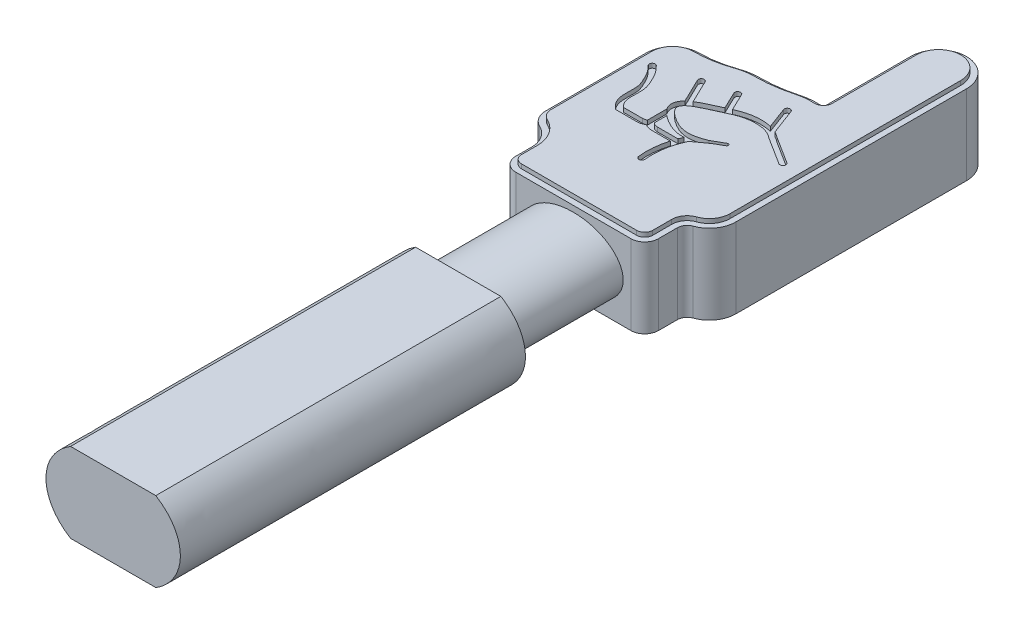
from build123d import *

# Parameters (mm, degrees)
BOSS_EXTRU_1_DEPTH  = 14.6
CUT_EXTRUDE1_DEPTH  = 0.75
CUT_EXTRUDE2_START  = -0.75
CUT_EXTRUDE2_DEPTH  = 0.75
SKETCH3_RX          = 8.68108217
SKETCH3_RY          = 5.903845931
BOSS_EXTRUDE1_DEPTH = 20
BOSS_EXTRUDE4_DEPTH = 60


with BuildPart() as part:
    # Esquisse2 → Boss.-Extru.1 (new body)
    with BuildSketch(Plane(origin=(0, 0, 0), x_dir=(1, 0, 0), z_dir=(0, 1, 0))):
        with BuildLine():
            Line((-461.351388226, 50.678431152), (-461.351388226, 90.775522892))
            ThreePointArc((-461.351388226, 90.775522892), (-466.211366791, 95.635501457), (-471.071345356, 90.775522892))
            Line((-471.071345356, 90.775522892), (-471.071345356, 76.175522892))
            ThreePointArc((-471.071345356, 76.175522892), (-471.248130994, 75.769164395), (-471.66594897, 75.621487285))
            ThreePointArc((-471.66594897, 75.621487285), (-473.268553235, 75.597795011), (-474.843817202, 75.302083679))
            ThreePointArc((-474.843817202, 75.302083679), (-477.875381422, 74.67740473), (-480.963538252, 74.467898632))
            ThreePointArc((-480.963538252, 74.467898632), (-482.600253942, 74.327779354), (-484.189336279, 73.911499414))
            ThreePointArc((-484.189336279, 73.911499414), (-487.044689997, 73.163503891), (-489.985634038, 72.911729587))
            ThreePointArc((-489.985634038, 72.911729587), (-493.246058953, 71.561217368), (-494.596571172, 68.300792453))
            Line((-494.596571172, 68.300792453), (-494.596571172, 50.839303584))
            ThreePointArc((-494.596571172, 50.839303584), (-494.110289111, 49.166185675), (-492.802956825, 48.014371421))
            ThreePointArc((-492.802956825, 48.014371421), (-491.037015464, 46.458503449), (-490.380146806, 44.198459732))
            Line((-490.380146806, 44.198459732), (-490.380146806, 41.432618273))
            ThreePointArc((-490.380146806, 41.432618273), (-489.677889469, 39.737219085), (-487.982490281, 39.034961748))
            Line((-487.982490281, 39.034961748), (-467.962472456, 39.034961748))
            ThreePointArc((-467.962472456, 39.034961748), (-466.267073268, 39.737219085), (-465.564815931, 41.432618273))
            Line((-465.564815931, 41.432618273), (-465.564815931, 44.736417722))
            ThreePointArc((-465.564815931, 44.736417722), (-465.25323649, 45.714489805), (-464.433325852, 46.332108859))
            ThreePointArc((-464.433325852, 46.332108859), (-462.200064163, 48.014371421), (-461.351388226, 50.678431152))
        make_face()
    extrude(amount=BOSS_EXTRU_1_DEPTH)

    # Esquisse4 → Cut-Extrude1 (cut)
    with BuildSketch(Plane(origin=(0, 14.6, 0), x_dir=(1, 0, 0), z_dir=(0, 1, 0))):
        with BuildLine():
            Line((-470.759038399, 66.876254444), (-472.431256119, 71.341307125))
            ThreePointArc((-472.431256119, 71.341307125), (-473.074857274, 71.634185177), (-473.367735327, 70.990584023))
            Line((-473.367735327, 70.990584023), (-471.993157719, 67.320271624))
            add(Edge.make_bspline(
                [(-471.993157719, 67.320271624), (-472.180478604, 67.36498208), (-473.344002436, 67.587235479), (-475.479739271, 67.472490346), (-477.043546697, 66.90883882), (-477.828675922, 66.569064368)],
                knots=[0.068797937, 0.068797937, 0.068797937, 0.068797937, 0.085212198, 0.170424395, 0.255222354, 0.255222354, 0.255222354, 0.255222354], degree=3))
            Line((-477.828675922, 66.569064368), (-479.267266322, 69.577025126))
            ThreePointArc((-479.267266322, 69.577025126), (-479.934061212, 69.812364403), (-480.169400489, 69.145569513))
            Line((-480.169400489, 69.145569513), (-478.739708759, 66.156215062))
            add(Edge.make_bspline(
                [(-478.739708759, 66.156215062), (-478.841024014, 66.108993774), (-479.354480109, 65.868730534), (-480.336105389, 65.411150949), (-481.572356528, 64.836708033), (-482.243555734, 64.447144423), (-482.434113402, 64.325134018)],
                knots=[0.287644358, 0.287644358, 0.287644358, 0.287644358, 0.298242692, 0.340848791, 0.38345489, 0.401256901, 0.401256901, 0.401256901, 0.401256901], degree=3))
            Line((-482.434113402, 64.325134018), (-484.376696119, 68.359024433))
            ThreePointArc((-484.376696119, 68.359024433), (-485.044120706, 68.592571896), (-485.277668173, 67.92514731))
            Line((-485.277668173, 67.92514731), (-483.244253147, 63.702638116))
            add(Edge.make_bspline(
                [(-483.244253147, 63.702638116), (-483.418919034, 63.535954123), (-483.760315122, 63.142157659), (-484.042020949, 62.414395148), (-483.98092589, 61.705227649), (-483.81969142, 61.284857812), (-483.685609155, 61.05413183), (-483.620520673, 60.956427528)],
                knots=[0.428301618, 0.428301618, 0.428301618, 0.428301618, 0.447364038, 0.468667087, 0.479318612, 0.489970137, 0.498689123, 0.498689123, 0.498689123, 0.498689123], degree=3))
            Line((-483.620520673, 60.956427528), (-483.620520673, 57.597881669))
            ThreePointArc((-483.620520673, 57.597881669), (-483.937770251, 57.455882294), (-484.281674888, 57.405476759))
            Line((-484.281674888, 57.405476759), (-487.605186099, 57.405476759))
            add(Edge.make_bspline(
                [(-490.458271221, 65.889651605), (-489.964259208, 65.347801564), (-489.257587251, 64.008444797), (-488.043116631, 61.175336728), (-489.057887679, 58.585169194), (-487.605186099, 57.405476759)],
                knots=[0, 0, 0, 0, 0.249547348, 0.474449153, 1, 1, 1, 1], degree=3))
            Line((-490.458271221, 65.889651605), (-491.048066053, 66.536559667))
            ThreePointArc((-491.048066053, 66.536559667), (-491.754419993, 66.569180401), (-491.787040726, 65.862826461))
            Line((-491.787040726, 65.862826461), (-491.197245894, 65.215918399))
            add(Edge.make_bspline(
                [(-491.197245894, 65.215918399), (-491.095097262, 65.103878105), (-490.913977468, 64.874895205), (-490.547291291, 64.301678952), (-490.112893659, 63.432242493), (-489.67204398, 62.416186706), (-489.504878635, 61.586502311), (-489.545778679, 60.45666192), (-489.577909133, 59.345919755), (-489.409307696, 58.369978179), (-489.164894876, 57.743514674), (-488.855110289, 57.261917218), (-488.580019374, 56.929642688), (-488.203701982, 56.597390566), (-488.049329474, 56.477953416), (-487.960080001, 56.405476808)],
                knots=[0, 0, 0, 0, 0.06457641, 0.129152819, 0.258305639, 0.387458458, 0.516611277, 0.645764097, 0.774916916, 0.839493325, 0.904069735, 0.93635794, 0.968646145, 1.00093435, 1.033222554, 1.033222554, 1.033222554, 1.033222554], degree=3))
            Line((-487.960080001, 56.405476808), (-484.27830747, 56.405476808))
            ThreePointArc((-484.27830747, 56.405476808), (-483.619158654, 56.507503464), (-483.018252357, 56.796982689))
            ThreePointArc((-483.018252357, 56.796982689), (-482.407788066, 56.505542911), (-481.738765966, 56.405476808))
            Line((-481.738765966, 56.405476808), (-478.488031211, 56.405476808))
            ThreePointArc((-478.488031211, 56.405476808), (-478.957737586, 53.904962522), (-478.929991667, 51.360866232))
            ThreePointArc((-478.929991667, 51.360866232), (-478.378479008, 50.918335117), (-477.935947893, 51.469847775))
            ThreePointArc((-477.935947893, 51.469847775), (-477.83656682, 54.786935808), (-476.829735496, 57.949093346))
            add(Edge.make_bspline(
                [(-474.508389009, 59.630573263), (-475.39957607, 58.974494681), (-476.829735496, 57.949093346)],
                knots=[0.955294065, 0.955294065, 0.955294065, 1, 1, 1], degree=2))
            Line((-474.508389009, 59.630573263), (-472.899170253, 60.555580278))
            ThreePointArc((-472.899170253, 60.555580278), (-472.798739907, 60.927560405), (-473.170720034, 61.027990752))
            Line((-473.170720034, 61.027990752), (-475.200560004, 59.861203335))
            add(Edge.make_bspline(
                [(-470.402527361, 65.460857516), (-471.656956737, 66.515168583), (-475.322492763, 66.806340084), (-478.871859969, 64.906936953), (-484.363975035, 62.557505369), (-480.712618445, 59.603798607), (-478.225902463, 58.808845566), (-475.900969447, 59.583081624), (-475.200560004, 59.861203335)],
                knots=[0, 0, 0, 0, 0.16361185, 0.327509924, 0.477241817, 0.563600697, 0.697734382, 0.765481354, 0.765481354, 0.765481354, 0.765481354], degree=3))
            ThreePointArc((-470.402527361, 65.460857516), (-470.39519915, 65.413665236), (-470.34800687, 65.420993448))
            Line((-470.34800687, 65.420993448), (-465.618535182, 62.431067479))
            ThreePointArc((-465.618535182, 62.431067479), (-464.928726258, 62.586514085), (-465.084172863, 63.27632301))
            Line((-465.084172863, 63.27632301), (-469.785886114, 66.248700365))
            add(Edge.make_bspline(
                [(-469.785886114, 66.248700365), (-470.08228622, 66.493908564), (-470.414152153, 66.704476344), (-470.759038399, 66.876254444)],
                knots=[0.000946473, 0.000946473, 0.000946473, 0.000946473, 0.032279754, 0.032279754, 0.032279754, 0.032279754], degree=3))
        make_face()
        with BuildLine():
            ThreePointArc((-477.834269574, 58.161899431), (-477.998837916, 57.786197293), (-478.151437751, 57.405476759))
            Line((-478.151437751, 57.405476759), (-481.738765966, 57.405476759))
            ThreePointArc((-481.738765966, 57.405476759), (-482.213049829, 57.496092802), (-482.620520673, 57.755175725))
            Line((-482.620520673, 57.755175725), (-482.620520673, 59.923424064))
            add(Edge.make_bspline(
                [(-482.620520673, 59.923424064), (-482.437562835, 59.77785948), (-481.806793393, 59.321946019), (-480.7515692, 58.705977162), (-479.366332949, 58.209178182), (-478.336605496, 58.132512954), (-477.834269574, 58.161899431)],
                knots=[0.535685582, 0.535685582, 0.535685582, 0.535685582, 0.553879285, 0.596485384, 0.639091483, 0.681697582, 0.681697582, 0.681697582, 0.681697582], degree=3))
        make_face(mode=Mode.SUBTRACT)
    extrude(amount=-CUT_EXTRUDE1_DEPTH, mode=Mode.SUBTRACT)

    # Sketch1 → Cut-Extrude2 (cut)
    with BuildSketch(Plane(origin=(0, 14.6, 0), x_dir=(1, 0, 0), z_dir=(0, 1, 0)).offset(CUT_EXTRUDE2_START)):
        with BuildLine():
            Line((-461.351388226, 50.678431152), (-461.351388226, 90.775522892))
            ThreePointArc((-461.351388226, 90.775522892), (-466.211366791, 95.635501457), (-471.071345356, 90.775522892))
            Line((-471.071345356, 90.775522892), (-471.071345356, 76.175522892))
            ThreePointArc((-471.071345356, 76.175522892), (-471.248130994, 75.769164395), (-471.66594897, 75.621487285))
            ThreePointArc((-471.66594897, 75.621487285), (-473.268553235, 75.597795011), (-474.843817202, 75.302083679))
            ThreePointArc((-474.843817202, 75.302083679), (-477.875381422, 74.67740473), (-480.963538252, 74.467898632))
            ThreePointArc((-480.963538252, 74.467898632), (-482.600253942, 74.327779354), (-484.189336279, 73.911499414))
            ThreePointArc((-484.189336279, 73.911499414), (-487.044689997, 73.163503891), (-489.985634038, 72.911729587))
            ThreePointArc((-489.985634038, 72.911729587), (-493.246058953, 71.561217368), (-494.596571172, 68.300792453))
            Line((-494.596571172, 68.300792453), (-494.596571172, 50.839303584))
            ThreePointArc((-494.596571172, 50.839303584), (-494.110289111, 49.166185675), (-492.802956825, 48.014371421))
            ThreePointArc((-492.802956825, 48.014371421), (-491.037015464, 46.458503449), (-490.380146806, 44.198459732))
            Line((-490.380146806, 44.198459732), (-490.380146806, 41.432618273))
            ThreePointArc((-490.380146806, 41.432618273), (-489.677889469, 39.737219085), (-487.982490281, 39.034961748))
            Line((-487.982490281, 39.034961748), (-467.962472456, 39.034961748))
            ThreePointArc((-467.962472456, 39.034961748), (-466.267073268, 39.737219085), (-465.564815931, 41.432618273))
            Line((-465.564815931, 41.432618273), (-465.564815931, 44.736417722))
            ThreePointArc((-465.564815931, 44.736417722), (-465.25323649, 45.714489805), (-464.433325852, 46.332108859))
            ThreePointArc((-464.433325852, 46.332108859), (-462.200064163, 48.014371421), (-461.351388226, 50.678431152))
        make_face()
        with BuildLine():
            Line((-462.351388226, 50.678431152), (-462.351388226, 90.775522892))
            ThreePointArc((-462.351388226, 90.775522892), (-466.211366791, 94.635501457), (-470.071345356, 90.775522892))
            Line((-470.071345356, 90.775522892), (-470.071345356, 76.175522892))
            ThreePointArc((-470.071345356, 76.175522892), (-470.566423079, 75.037539957), (-471.736497608, 74.623978944))
            ThreePointArc((-471.736497608, 74.623978944), (-473.168548328, 74.602808068), (-474.576168379, 74.338567147))
            ThreePointArc((-474.576168379, 74.338567147), (-477.740319459, 73.686567576), (-480.963538252, 73.467898632))
            ThreePointArc((-480.963538252, 73.467898632), (-482.430279639, 73.342330859), (-483.854334437, 72.969281942))
            ThreePointArc((-483.854334437, 72.969281942), (-486.874715694, 72.178055396), (-489.985634038, 71.911729587))
            ThreePointArc((-489.985634038, 71.911729587), (-492.538952172, 70.854110587), (-493.596571172, 68.300792453))
            Line((-493.596571172, 68.300792453), (-493.596571172, 50.839303584))
            ThreePointArc((-493.596571172, 50.839303584), (-493.266077191, 49.702195222), (-492.377569295, 48.919382719))
            ThreePointArc((-492.377569295, 48.919382719), (-490.192803545, 46.994512997), (-489.380146806, 44.198459732))
            Line((-489.380146806, 44.198459732), (-489.380146806, 41.432618273))
            ThreePointArc((-489.380146806, 41.432618273), (-488.970782687, 40.444325866), (-487.982490281, 40.034961748))
            Line((-487.982490281, 40.034961748), (-467.962472456, 40.034961748))
            ThreePointArc((-467.962472456, 40.034961748), (-466.974180049, 40.444325866), (-466.564815931, 41.432618273))
            Line((-466.564815931, 41.432618273), (-466.564815931, 44.736417722))
            ThreePointArc((-466.564815931, 44.736417722), (-466.068969381, 46.292918583), (-464.764166151, 47.275795616))
            ThreePointArc((-464.764166151, 47.275795616), (-463.015797054, 48.592800198), (-462.351388226, 50.678431152))
        make_face(mode=Mode.SUBTRACT)
    extrude(amount=CUT_EXTRUDE2_DEPTH, mode=Mode.SUBTRACT)

    # Sketch3 → Boss-Extrude1 (add)
    with BuildSketch(Plane.XY.offset(-39.034961748)):
        with Locations(Location((-477.982490281, 6.925), (0, 0, 180))):
            Ellipse(SKETCH3_RX, SKETCH3_RY)
    extrude(amount=BOSS_EXTRUDE1_DEPTH)

    # Sketch4 → Boss-Extrude4 (add)
    with BuildSketch(Plane.XY.offset(-19.034961748)):
        with BuildLine():
            Line((-470.573062726, 13.85), (-485.391908294, 13.85))
            add(Edge.make_bspline(
                [(-485.391908294, 13.85), (-485.488999074, 13.790056619), (-485.585235649, 13.7286323), (-485.962723407, 13.479502229), (-486.237158914, 13.279980124), (-486.768829032, 12.851114676), (-487.023449892, 12.623706188), (-487.743849573, 11.90730237), (-488.170169312, 11.38208296), (-488.89263368, 10.216743161), (-489.172313008, 9.602614579), (-489.461501626, 8.633127328), (-489.536195257, 8.300778151), (-489.637213805, 7.622273312), (-489.687889874, 6.944985449), (-489.641175572, 6.270051898), (-489.545254124, 5.596307878), (-489.471912667, 5.25872709), (-489.281075729, 4.605829736), (-489.163414247, 4.287884562), (-488.885803143, 3.668160967), (-488.724708294, 3.364641633), (-488.187444245, 2.491539454), (-487.761893309, 1.962821172), (-487.036754895, 1.238484577), (-486.781404202, 1.00986698), (-486.254390982, 0.583127927), (-485.882952496, 0.311774738), (-485.495698512, 0.064093077), (-485.391848479, 0)],
                knots=[0.369718413, 0.369718413, 0.369718413, 0.369718413, 0.375, 0.375, 0.390625, 0.390625, 0.40625, 0.40625, 0.4375, 0.4375, 0.46875, 0.46875, 0.484375, 0.484375, 0.5, 0.515625, 0.515625, 0.53125, 0.53125, 0.546875, 0.546875, 0.5625, 0.5625, 0.59375, 0.59375, 0.609375, 0.609375, 0.625, 0.630643822, 0.630643822, 0.630643822, 0.630643822], degree=3))
            Line((-485.391848479, 0), (-470.573194506, 0))
            add(Edge.make_bspline(
                [(-470.573194506, 0), (-470.471391382, 0.062817646), (-470.37068115, 0.127162021), (-469.704664404, 0.568057429), (-469.177295463, 0.991084228), (-468.455521373, 1.709989833), (-468.225247421, 1.965584957), (-467.799555111, 2.49809142), (-467.603788057, 2.774919752), (-467.248172545, 3.350816628), (-467.088306697, 3.649874404), (-466.807698089, 4.272214335), (-466.687682564, 4.595070342), (-466.400920437, 5.569775396), (-466.301408111, 6.238767836), (-466.301408111, 7.611232164), (-466.400614594, 8.280037623), (-466.688929759, 9.258740154), (-466.809356414, 9.581748722), (-467.088822817, 10.200982842), (-467.24841539, 10.499669502), (-467.604773621, 11.076583128), (-467.802554324, 11.356018522), (-468.229438626, 11.889293642), (-468.456939939, 12.141496167), (-468.937332198, 12.619832789), (-469.190235624, 12.845954073), (-469.719754138, 13.273851045), (-469.99711963, 13.47593063), (-470.377071241, 13.726927882), (-470.474671482, 13.78925097), (-470.573062726, 13.85)],
                knots=[0.869522684, 0.869522684, 0.869522684, 0.869522684, 0.875, 0.875, 0.90625, 0.90625, 0.921875, 0.921875, 0.9375, 0.9375, 0.953125, 0.953125, 0.96875, 0.96875, 1, 1, 1.03125, 1.03125, 1.046875, 1.046875, 1.0625, 1.0625, 1.078125, 1.078125, 1.09375, 1.09375, 1.109375, 1.109375, 1.125, 1.125, 1.130340799, 1.130340799, 1.130340799, 1.130340799], degree=3))
        make_face()
    extrude(amount=BOSS_EXTRUDE4_DEPTH)


solid = part.part
